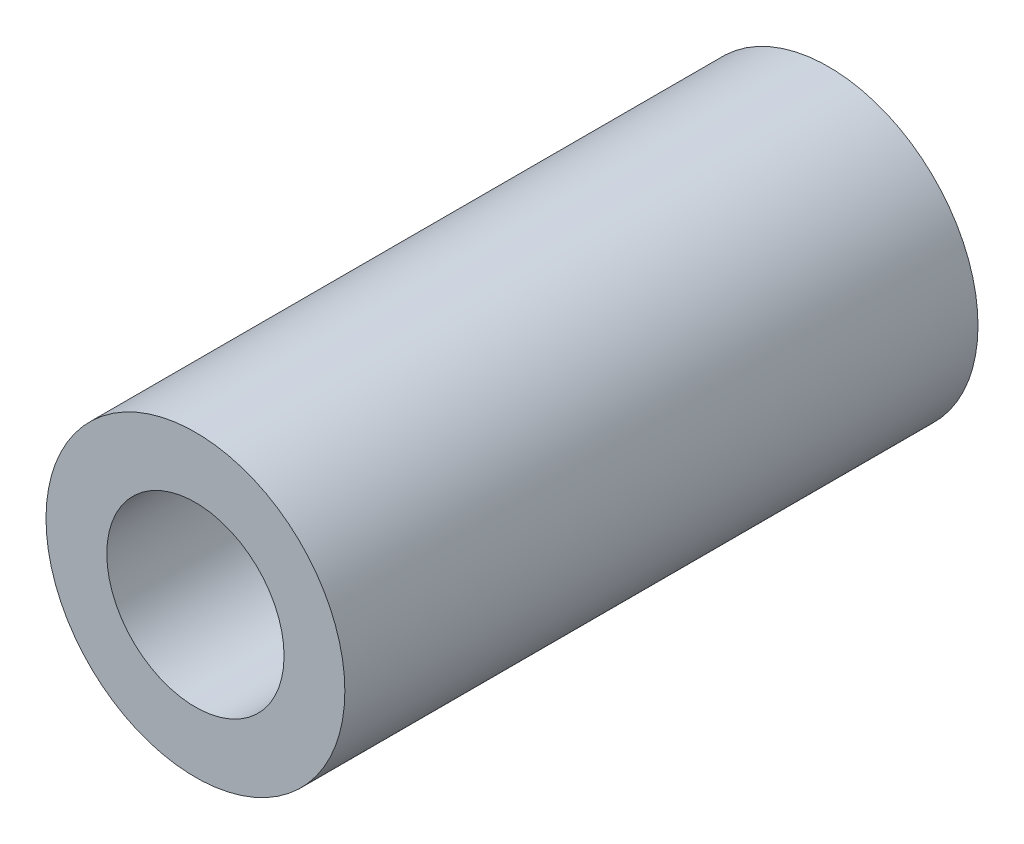
from build123d import *

# Parameters (mm, degrees)
SKETCH1_R           = 11.8
SKETCH1_R_2         = 7
BOSS_EXTRUDE1_DEPTH = 50


with BuildPart() as part:
    # Sketch1 → Boss-Extrude1 (new body)
    with BuildSketch(Plane.XY):
        Circle(SKETCH1_R)
        Circle(SKETCH1_R_2, mode=Mode.SUBTRACT)
    extrude(amount=BOSS_EXTRUDE1_DEPTH)


solid = part.part
